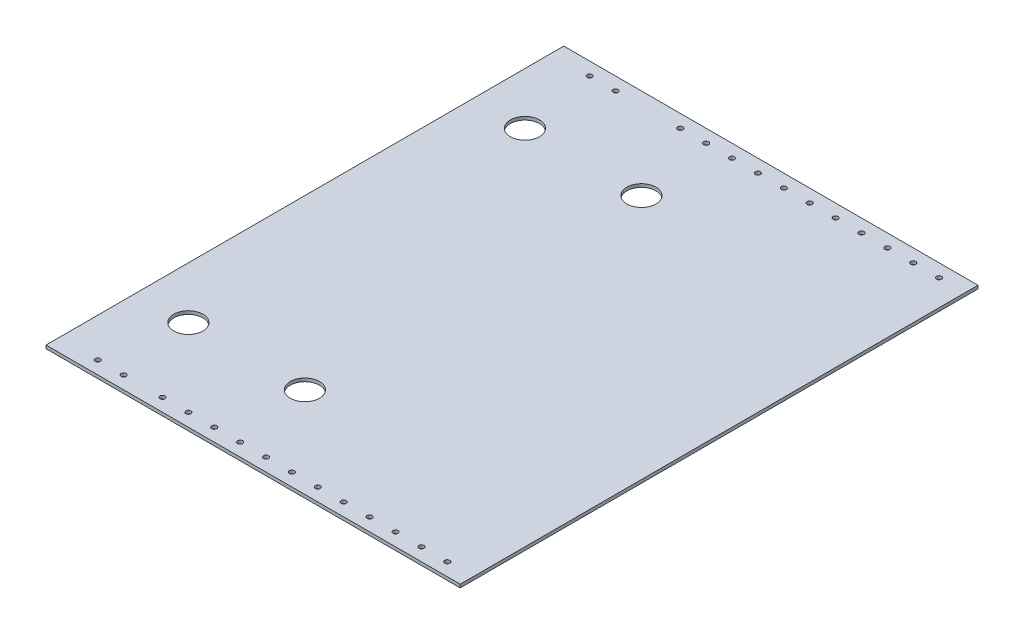
from build123d import *

# Parameters (mm, degrees)
SKETCH1_W               = 406.4
SKETCH1_H               = 508
BOSS_EXTRUDE1_DEPTH     = 3.175
SKETCH2_R               = 14.2875
CUT_EXTRUDE1_DEPTH      = 3.175
CUT_EXTRUDE2_DEPTH      = 651.56517016
CUT_EXTRUDE2_DEPTH_BACK = 651.56517016
SKETCH3_R               = 2.4892


with BuildPart() as part:
    # Sketch1 → Boss-Extrude1 (new body)
    with BuildSketch(Plane(origin=(0, 0, 0), x_dir=(1, 0, 0), z_dir=(0, 1, 0))):
        with Locations((203.2, 254)):
            Rectangle(SKETCH1_W, SKETCH1_H)
    extrude(amount=BOSS_EXTRUDE1_DEPTH)

    # Sketch2 → Cut-Extrude1 (cut)
    with BuildSketch(Plane(origin=(0, 3.175, 0), x_dir=(1, 0, 0), z_dir=(0, 1, 0))):
        with Locations((50.8, 419.1)):
            Circle(SKETCH2_R)
        with Locations((165.1, 419.1)):
            Circle(SKETCH2_R)
        with Locations((50.8, 88.9)):
            Circle(SKETCH2_R)
        with Locations((165.1, 88.9)):
            Circle(SKETCH2_R)
    extrude(amount=-CUT_EXTRUDE1_DEPTH, mode=Mode.SUBTRACT)

    # Sketch3 → Cut-Extrude2 (cut, two sides: drawn at the far end of the back side and taken through both)
    with BuildSketch(Plane(origin=(0, 3.175, 0), x_dir=(1, 0, 0), z_dir=(0, 1, 0)).offset(-CUT_EXTRUDE2_DEPTH_BACK)):
        with Locations((38.1, 12.7)):
            Circle(SKETCH3_R)
        with Locations((63.5, 12.7)):
            Circle(SKETCH3_R)
        with Locations((127, 12.7)):
            Circle(SKETCH3_R)
        with Locations((152.4, 12.7)):
            Circle(SKETCH3_R)
        with Locations((177.8, 12.7)):
            Circle(SKETCH3_R)
        with Locations((203.2, 12.7)):
            Circle(SKETCH3_R)
        with Locations((228.6, 12.7)):
            Circle(SKETCH3_R)
        with Locations((254, 12.7)):
            Circle(SKETCH3_R)
        with Locations((279.4, 12.7)):
            Circle(SKETCH3_R)
        with Locations((304.8, 12.7)):
            Circle(SKETCH3_R)
        with Locations((330.2, 12.7)):
            Circle(SKETCH3_R)
        with Locations((355.6, 12.7)):
            Circle(SKETCH3_R)
        with Locations((381, 12.7)):
            Circle(SKETCH3_R)
        with Locations((381, 495.3)):
            Circle(SKETCH3_R)
        with Locations((355.6, 495.3)):
            Circle(SKETCH3_R)
        with Locations((330.2, 495.3)):
            Circle(SKETCH3_R)
        with Locations((304.8, 495.3)):
            Circle(SKETCH3_R)
        with Locations((279.4, 495.3)):
            Circle(SKETCH3_R)
        with Locations((254, 495.3)):
            Circle(SKETCH3_R)
        with Locations((228.6, 495.3)):
            Circle(SKETCH3_R)
        with Locations((203.2, 495.3)):
            Circle(SKETCH3_R)
        with Locations((177.8, 495.3)):
            Circle(SKETCH3_R)
        with Locations((152.4, 495.3)):
            Circle(SKETCH3_R)
        with Locations((127, 495.3)):
            Circle(SKETCH3_R)
        with Locations((63.5, 495.3)):
            Circle(SKETCH3_R)
        with Locations((38.1, 495.3)):
            Circle(SKETCH3_R)
        with Locations((101.6, 12.7)):
            Circle(SKETCH3_R)
    extrude(amount=CUT_EXTRUDE2_DEPTH + CUT_EXTRUDE2_DEPTH_BACK, mode=Mode.SUBTRACT)


solid = part.part
